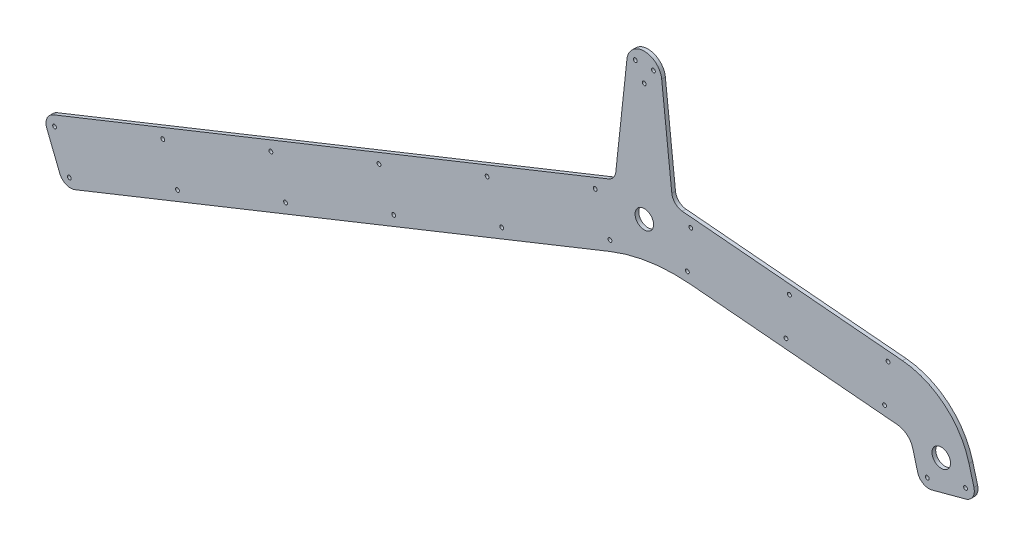
from build123d import *

# Parameters (mm, degrees)
SKETCH1_R                     = 7.9375
BASE_DEPTH                    = 3.175
FILLET1_R                     = 10
SKETCH2_R                     = 1.65
DIFFERENTIAL_ATTACHMENT_DEPTH = 561.184240235
SKETCH3_R                     = 1.65
STRUT_HOLES_DEPTH             = 561.184240235


with BuildPart() as part:
    # Sketch1 → Base (new body)
    with BuildSketch(Plane.XY):
        with BuildLine():
            Line((-25.142679348, 16.868752297), (-516.78145109, -179.7867564))
            Line((-516.78145109, -179.7867564), (-498.211917272, -226.210590945))
            Line((-498.211917272, -226.210590945), (-29.426356063, -38.696366461))
            ThreePointArc((-29.426356063, -38.696366461), (4.367965887, -29.577289686), (39.355606802, -28.53866538))
            Line((39.355606802, -28.53866538), (217.364311844, -44.11240908))
            ThreePointArc((217.364311844, -44.11240908), (225.698789848, -47.564662905), (230.545863097, -55.173043875))
            Line((230.545863097, -55.173043875), (237.32233047, -80.463164407))
            Line((237.32233047, -80.463164407), (285.618621785, -67.522212152))
            Line((285.618621785, -67.522212152), (278.842154412, -42.23209162))
            ThreePointArc((278.842154412, -42.23209162), (257.838170333, -9.262440749), (221.722098981, 5.697325825))
            Line((221.722098981, 5.697325825), (24.485725965, 22.953272498))
            Line((24.485725965, 22.953272498), (14.913323643, 111.610210516))
            ThreePointArc((14.913323643, 111.610210516), (0, 125), (-14.913323643, 111.610210516))
            Line((-14.913323643, 111.610210516), (-25.142679348, 16.868752297))
        make_face()
        Circle(SKETCH1_R, mode=Mode.SUBTRACT)
        with Locations((255, -49.844542622)):
            Circle(SKETCH1_R, mode=Mode.SUBTRACT)
    extrude(amount=BASE_DEPTH)

    # Fillet1
    fillet1_edges = [part.edges().sort_by_distance(p)[0] for p in [
        (24.485725965, 22.953272498, 1.5875),
        (-25.142679348, 16.868752297, 1.5875),
        (237.32233047, -80.463164407, 1.5875),
        (285.618621785, -67.522212152, 1.5875),
        (-498.211917272, -226.210590945, 1.5875),
        (-516.78145109, -179.7867564, 1.5875),
    ]]
    fillet(fillet1_edges, radius=FILLET1_R)

    # Sketch2 → Differential Attachment (cut, through all)
    with BuildSketch(Plane.XY.offset(3.175)):
        with Locations((-7.794228634, 114.5)):
            Circle(SKETCH2_R)
        with Locations((7.794228634, 114.5)):
            Circle(SKETCH2_R)
        with Locations((0, 101)):
            Circle(SKETCH2_R)
    extrude(amount=-DIFFERENTIAL_ATTACHMENT_DEPTH, mode=Mode.SUBTRACT)

    # Sketch3 → Strut Holes (cut, through all)
    with BuildSketch(Plane.XY.offset(3.175)):
        with Locations((-506.382512152, -184.243444517)):
            Circle(SKETCH3_R)
        with Locations((-493.755229156, -215.811652007)):
            Circle(SKETCH3_R)
        with Locations((-400.907560067, -178.672584371)):
            Circle(SKETCH3_R)
        with Locations((-413.534843063, -147.104376881)):
            Circle(SKETCH3_R)
        with Locations((-308.059890979, -141.533516736)):
            Circle(SKETCH3_R)
        with Locations((-320.687173975, -109.965309246)):
            Circle(SKETCH3_R)
        with Locations((-215.21222189, -104.3944491)):
            Circle(SKETCH3_R)
        with Locations((-227.839504886, -72.82624161)):
            Circle(SKETCH3_R)
        with Locations((-122.364552802, -67.255381465)):
            Circle(SKETCH3_R)
        with Locations((-134.991835798, -35.687173975)):
            Circle(SKETCH3_R)
        with Locations((-29.516883713, -30.11631383)):
            Circle(SKETCH3_R)
        with Locations((-42.144166709, 1.451893661)):
            Circle(SKETCH3_R)
        with Locations((39.925455205, 13.571912522)):
            Circle(SKETCH3_R)
        with Locations((36.962159952, -20.298707213)):
            Circle(SKETCH3_R)
        with Locations((124.602004543, 6.163674388)):
            Circle(SKETCH3_R)
        with Locations((121.638709289, -27.706945347)):
            Circle(SKETCH3_R)
        with Locations((209.278553881, -1.244563745)):
            Circle(SKETCH3_R)
        with Locations((206.315258627, -35.115183481)):
            Circle(SKETCH3_R)
        with Locations((242.97918472, -70.665205436)):
            Circle(SKETCH3_R)
        with Locations((275.820662814, -61.865357903)):
            Circle(SKETCH3_R)
    extrude(amount=-STRUT_HOLES_DEPTH, mode=Mode.SUBTRACT)


solid = part.part
